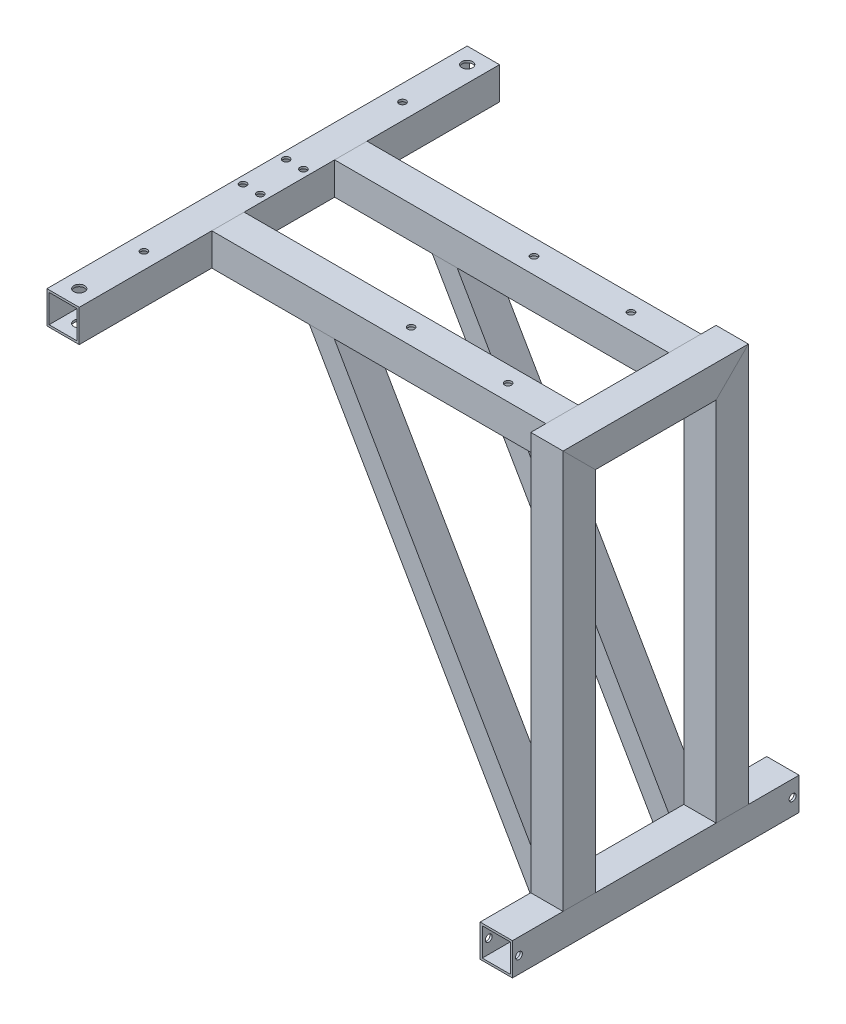
from build123d import *

# Parameters (mm, degrees)
SKETCH1_ON_SEGMENT_1_W       = 15
SKETCH1_ON_SEGMENT_1_H       = 15
SKETCH1_ON_SEGMENT_1_W_2     = 13
SKETCH1_ON_SEGMENT_1_H_2     = 13
F_20_X_20_X_2_1_DEPTH        = 197.606601718
SKETCH1_ON_SEGMENT_2_W       = 15
SKETCH1_ON_SEGMENT_2_H       = 15
SKETCH1_ON_SEGMENT_2_W_2     = 13
SKETCH1_ON_SEGMENT_2_H_2     = 13
F_20_X_20_X_2_1_2_DEPTH      = 94.213203436
F_20_X_20_X_2_1_3_DEPTH      = 186
F_20_X_20_X_2_1_3_DEPTH_BACK = 11.606601718
SKETCH1_W                    = 15
SKETCH1_H                    = 15
SKETCH1_W_2                  = 13
SKETCH1_H_2                  = 13
SKETCH1_ON_SEGMENT_4_W       = 15
SKETCH1_ON_SEGMENT_4_H       = 15
SKETCH1_ON_SEGMENT_4_W_2     = 13
SKETCH1_ON_SEGMENT_4_H_2     = 13
F_20_X_20_X_2_1_4_DEPTH      = 133
SKETCH1_ON_SEGMENT_5_W       = 15
SKETCH1_ON_SEGMENT_5_H       = 15
SKETCH1_ON_SEGMENT_5_W_2     = 13
SKETCH1_ON_SEGMENT_5_H_2     = 13
F_20_X_20_X_2_1_5_DEPTH      = 195
SKETCH1_ON_SEGMENT_6_W       = 15
SKETCH1_ON_SEGMENT_6_H       = 15
SKETCH1_ON_SEGMENT_6_W_2     = 13
SKETCH1_ON_SEGMENT_6_H_2     = 13
F_20_X_20_X_2_1_6_DEPTH      = 172
SKETCH1_ON_SEGMENT_7_W       = 15
SKETCH1_ON_SEGMENT_7_H       = 15
SKETCH1_ON_SEGMENT_7_W_2     = 13
SKETCH1_ON_SEGMENT_7_H_2     = 13
F_20_X_20_X_2_1_7_DEPTH      = 172
SKETCH_2_R                   = 2.5
SKETCH_2_R_2                 = 1.6
CUT_EXTRUDE_1_DEPTH          = 285.62694883
SWEEP_START                  = 21
SWEEP_1_DEPTH                = 15
SWEEP_1_2_DEPTH              = 1
SWEEP_START_2                = 35
SWEEP_1_3_DEPTH              = 1
SKETCH_6_R                   = 1.5
CUT_EXTRUDE_2_DEPTH          = 298.211621842
SKETCH_7_W                   = 15
SKETCH_7_H                   = 4.999995337
CUT_EXTRUDE_3_DEPTH          = 279.231015809
SKETCH_8_R                   = 1.6
CUT_EXTRUDE_4_DEPTH          = 285.231419797


# Read off the part's stored shape, not the designer's step: 扫描1
with BuildPart() as part:
    # Sketch1 on segment 1 (carried to segment 1) → 方形管 20 X 20 X 2(1) (new body)
    with BuildSketch(Plane(origin=(170, -186, -35.5), x_dir=(1, 0, 0), z_dir=(0, 1, 0))):
        Rectangle(SKETCH1_ON_SEGMENT_1_W, SKETCH1_ON_SEGMENT_1_H)
        Rectangle(SKETCH1_ON_SEGMENT_1_W_2, SKETCH1_ON_SEGMENT_1_H_2, mode=Mode.SUBTRACT)
    extrude(amount=F_20_X_20_X_2_1_DEPTH)

    # 方形管 20 X 20 X 2(1) mitre 1
    split(bisect_by=Plane(origin=(170, 0, -35.5), x_dir=(1, 0, 0), z_dir=(0, -0.707106781, -0.707106781)), keep=Keep.TOP)

    # 方形管 20 X 20 X 2(1) mitre 2
    split(bisect_by=Plane(origin=(170, -177.5, -35.5), x_dir=(-1, 0, 0), z_dir=(0, 1, 0)), keep=Keep.TOP)


with BuildPart() as body_2:
    # Sketch1 on segment 2 (carried to segment 2) → 20 X 20 X 2_1 2 (new body)
    with BuildSketch(Plane(origin=(170, 0, -47.106601718), x_dir=(1, 0, 0), z_dir=(0, 0, 1))):
        Rectangle(SKETCH1_ON_SEGMENT_2_W, SKETCH1_ON_SEGMENT_2_H)
        Rectangle(SKETCH1_ON_SEGMENT_2_W_2, SKETCH1_ON_SEGMENT_2_H_2, mode=Mode.SUBTRACT)
    extrude(amount=F_20_X_20_X_2_1_2_DEPTH)

    # 20 X 20 X 2_1 2 mitre 1
    split(bisect_by=Plane(origin=(170, 0, 35.5), x_dir=(-1, 0, 0), z_dir=(0, 0.707106781, -0.707106781)), keep=Keep.TOP)

    # 20 X 20 X 2_1 2 mitre 2
    split(bisect_by=Plane(origin=(170, 0, -35.5), x_dir=(-1, 0, 0), z_dir=(0, 0.707106781, 0.707106781)), keep=Keep.TOP)


with BuildPart() as body_3:
    # Sketch1 → 20 X 20 X 2_1 3 (new, two sides: drawn at the far end of the back side and taken through both)
    with BuildSketch(Plane(origin=(170, 0, 35.5), x_dir=(1, 0, 0), z_dir=(0, -1, 0)).offset(-F_20_X_20_X_2_1_3_DEPTH_BACK)):
        Rectangle(SKETCH1_W, SKETCH1_H)
        Rectangle(SKETCH1_W_2, SKETCH1_H_2, mode=Mode.SUBTRACT)
    extrude(amount=F_20_X_20_X_2_1_3_DEPTH + F_20_X_20_X_2_1_3_DEPTH_BACK)

    # 20 X 20 X 2_1 3 mitre 1
    split(bisect_by=Plane(origin=(170, 0, 35.5), x_dir=(1, 0, 0), z_dir=(0, -0.707106781, 0.707106781)), keep=Keep.TOP)

    # 20 X 20 X 2_1 3 mitre 2
    split(bisect_by=Plane(origin=(170, -177.5, 35.5), x_dir=(-1, 0, 0), z_dir=(0, 1, 0)), keep=Keep.TOP)


with BuildPart() as body_4:
    # Sketch1 on segment 4 (carried to segment 4) → 20 X 20 X 2_1 4 (new body)
    with BuildSketch(Plane(origin=(170, -185, 66.5), x_dir=(1, 0, 0), z_dir=(0, 0, -1))):
        Rectangle(SKETCH1_ON_SEGMENT_4_W, SKETCH1_ON_SEGMENT_4_H)
        Rectangle(SKETCH1_ON_SEGMENT_4_W_2, SKETCH1_ON_SEGMENT_4_H_2, mode=Mode.SUBTRACT)
    extrude(amount=F_20_X_20_X_2_1_4_DEPTH)

    # 草图8 → 切除-拉伸4 (cut, through all)
    with BuildSketch(Plane(origin=(177.5, 0, 0), x_dir=(0, 0, -1), z_dir=(1, 0, 0))):
        with Locations((-63.5, -185)):
            Circle(SKETCH_8_R)
        with Locations(Location((63.5, -185, 0), (0, 0, 180))):
            Circle(SKETCH_8_R)
    extrude(amount=-CUT_EXTRUDE_4_DEPTH, mode=Mode.SUBTRACT)


with BuildPart() as body_5:
    # Sketch1 on segment 5 (carried to segment 5) → 20 X 20 X 2_1 5 (new body)
    with BuildSketch(Plane.XY.offset(-97.5)):
        Rectangle(SKETCH1_ON_SEGMENT_5_W, SKETCH1_ON_SEGMENT_5_H)
        Rectangle(SKETCH1_ON_SEGMENT_5_W_2, SKETCH1_ON_SEGMENT_5_H_2, mode=Mode.SUBTRACT)
    extrude(amount=F_20_X_20_X_2_1_5_DEPTH)


with BuildPart() as body_6:
    # Sketch1 on segment 6 (carried to segment 6) → 20 X 20 X 2_1 6 (new body)
    with BuildSketch(Plane(origin=(-1, 0, 28.5), x_dir=(0, 1, 0), z_dir=(1, 0, 0))):
        Rectangle(SKETCH1_ON_SEGMENT_6_W, SKETCH1_ON_SEGMENT_6_H)
        Rectangle(SKETCH1_ON_SEGMENT_6_W_2, SKETCH1_ON_SEGMENT_6_H_2, mode=Mode.SUBTRACT)
    extrude(amount=F_20_X_20_X_2_1_6_DEPTH)

    # 20 X 20 X 2_1 6 mitre 1
    split(bisect_by=Plane(origin=(7.5, 0, 28.5), x_dir=(0, 1, 0), z_dir=(1, 0, 0)), keep=Keep.TOP)

    # 20 X 20 X 2_1 6 mitre 2
    split(bisect_by=Plane(origin=(162.5, 0, 28.5), x_dir=(0, -1, 0), z_dir=(-1, 0, 0)), keep=Keep.TOP)


with BuildPart() as body_7:
    # Sketch1 on segment 7 (carried to segment 7) → 20 X 20 X 2_1 7 (new body)
    with BuildSketch(Plane(origin=(-1, 0, -28.5), x_dir=(0, 1, 0), z_dir=(1, 0, 0))):
        Rectangle(SKETCH1_ON_SEGMENT_7_W, SKETCH1_ON_SEGMENT_7_H)
        Rectangle(SKETCH1_ON_SEGMENT_7_W_2, SKETCH1_ON_SEGMENT_7_H_2, mode=Mode.SUBTRACT)
    extrude(amount=F_20_X_20_X_2_1_7_DEPTH)

    # 20 X 20 X 2_1 7 mitre 1
    split(bisect_by=Plane(origin=(7.5, 0, -28.5), x_dir=(0, 1, 0), z_dir=(1, 0, 0)), keep=Keep.TOP)

    # 20 X 20 X 2_1 7 mitre 2
    split(bisect_by=Plane(origin=(162.5, 0, -28.5), x_dir=(0, -1, 0), z_dir=(-1, 0, 0)), keep=Keep.TOP)


with BuildPart() as cut_extrude_1_tool:
    # 草图2 → 切除-拉伸1 (new, through all)
    with BuildSketch(Plane(origin=(0, 7.5, 0), x_dir=(1, 0, 0), z_dir=(0, 1, 0))):
        with Locations(Location((0, -90, 0), (0, 0, 270))):
            Circle(SKETCH_2_R)
        with Locations(Location((0, 90, 0), (0, 0, 90))):
            Circle(SKETCH_2_R)
        with Locations(Location((92.5, -28.5, 0), (0, 0, 270))):
            Circle(SKETCH_2_R_2)
        with Locations(Location((92.5, 28.5, 0), (0, 0, 90))):
            Circle(SKETCH_2_R_2)
        with Locations(Location((4, 10, 0), (0, 0, 270))):
            Circle(SKETCH_2_R_2)
        with Locations(Location((-4, 10, 0), (0, 0, 90))):
            Circle(SKETCH_2_R_2)
        with Locations(Location((4, -10, 0), (0, 0, 90))):
            Circle(SKETCH_2_R_2)
        with Locations(Location((-4, -10, 0), (0, 0, 270))):
            Circle(SKETCH_2_R_2)
        with Locations(Location((0, -60, 0), (0, 0, 270))):
            Circle(SKETCH_2_R_2)
        with Locations(Location((0, 60, 0), (0, 0, 90))):
            Circle(SKETCH_2_R_2)
        with Locations(Location((137.5, -28.5, 0), (0, 0, 270))):
            Circle(SKETCH_2_R_2)
        with Locations(Location((137.5, 28.5, 0), (0, 0, 90))):
            Circle(SKETCH_2_R_2)
    extrude(amount=-CUT_EXTRUDE_1_DEPTH)


with BuildPart() as body_5_1:
    add(body_5.part)

    # 切除-拉伸1: cut by cut_extrude_1_tool
    add(cut_extrude_1_tool.part, mode=Mode.SUBTRACT)


with BuildPart() as body_6_1:
    add(body_6.part)

    # 切除-拉伸1: cut by cut_extrude_1_tool
    add(cut_extrude_1_tool.part, mode=Mode.SUBTRACT)


with BuildPart() as body_7_1:
    add(body_7.part)

    # 切除-拉伸1: cut by cut_extrude_1_tool
    add(cut_extrude_1_tool.part, mode=Mode.SUBTRACT)


with BuildPart() as body_8:
    # 扫描1 outline → 扫描1 (new body)
    with BuildSketch(Plane.XY.offset(SWEEP_START)):
        Polygon((52.803451546, -7.5), (162.5, -197.499995337), (162.5, -195.76794453), (53.803451546, -7.5), align=None)
        Polygon((63.350451546, -7.5), (162.5, -179.23205547), (162.5, -177.500004663), (64.350451546, -7.5), align=None)
    extrude(amount=SWEEP_1_DEPTH)

    # Sweep 1 2 outline → Sweep 1 2 (add)
    with BuildSketch(Plane.XY.offset(SWEEP_START)):
        Polygon((53.803451546, -7.5), (162.5, -195.76794453), (162.5, -179.23205547), (63.350451546, -7.5), align=None)
    extrude(amount=SWEEP_1_2_DEPTH)

    # Sweep 1 3 outline → Sweep 1 3 (add)
    with BuildSketch(Plane.XY.offset(SWEEP_START_2)):
        Polygon((53.803451546, -7.5), (162.5, -195.76794453), (162.5, -179.23205547), (63.350451546, -7.5), align=None)
    extrude(amount=SWEEP_1_3_DEPTH)


with BuildPart() as body_9:
    # 镜向1: mirrored copy
    add(body_8.part.mirror(Plane.XY))


with BuildPart() as cut_extrude_2_tool:
    # 草图6 → 切除-拉伸2 (new, through all)
    with BuildSketch(Plane.XY.offset(36)):
        with Locations((158, -185)):
            Circle(SKETCH_6_R)
    extrude(amount=-CUT_EXTRUDE_2_DEPTH)


with BuildPart() as body_8_1:
    add(body_8.part)

    # 切除-拉伸2: cut by cut_extrude_2_tool
    add(cut_extrude_2_tool.part, mode=Mode.SUBTRACT)


with BuildPart() as body_9_1:
    add(body_9.part)

    # 切除-拉伸2: cut by cut_extrude_2_tool
    add(cut_extrude_2_tool.part, mode=Mode.SUBTRACT)


with BuildPart() as cut_extrude_3_tool:
    # 草图7 → 切除-拉伸3 (new, through all)
    with BuildSketch(Plane(origin=(162.5, 0, 0), x_dir=(0, 0, -1), z_dir=(1, 0, 0))):
        with Locations((-28.5, -194.999997668)):
            Rectangle(SKETCH_7_W, SKETCH_7_H)
        with Locations((28.5, -194.999997668)):
            Rectangle(SKETCH_7_W, SKETCH_7_H)
    extrude(amount=-CUT_EXTRUDE_3_DEPTH)


with BuildPart() as body_8_2:
    add(body_8_1.part)

    # 切除-拉伸3: cut by cut_extrude_3_tool
    add(cut_extrude_3_tool.part, mode=Mode.SUBTRACT)


with BuildPart() as body_9_2:
    add(body_9_1.part)

    # 切除-拉伸3: cut by cut_extrude_3_tool
    add(cut_extrude_3_tool.part, mode=Mode.SUBTRACT)


solid = Compound([part.part, body_2.part, body_3.part, body_4.part, body_5_1.part, body_6_1.part, body_7_1.part, body_8_2.part, body_9_2.part])
